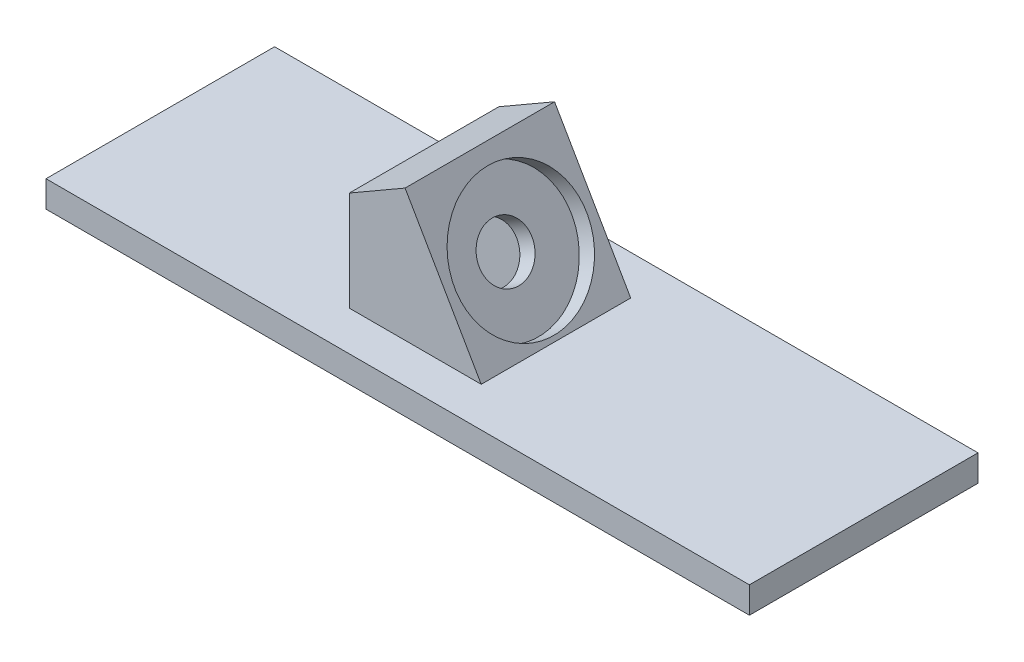
from build123d import *

# Parameters (mm, degrees)
ESBO_O1_R                  = 1.5
RESSALTO_EXTRUS_O1_DEPTH   = 12
RESSALTO_EXTRUS_O1_2_DEPTH = 12
ESBO_O1_R_2                = 1.500000005
RESSALTO_EXTRUS_O1_3_DEPTH = 12
RESSALTO_EXTRUS_O1_4_DEPTH = 12
RESSALTO_EXTRUS_O1_5_DEPTH = 12
RESSALTO_EXTRUS_O1_6_DEPTH = 12
ESBO_O1_R_3                = 1.500000003
RESSALTO_EXTRUS_O1_7_DEPTH = 12
RESSALTO_EXTRUS_O1_8_DEPTH = 12
ESBO_O2_W                  = 79.998506149
ESBO_O2_H                  = 25.999999951
RESSALTO_EXTRUS_O2_DEPTH   = 3
ESBO_O3_W                  = 15
ESBO_O3_H                  = 17
RESSALTO_EXTRUS_O3_DEPTH   = 15
CHANFRO1_START             = 28.832866647
CHANFRO1_OUTLINE_W         = 17.320508076
CHANFRO1_OUTLINE_H         = 17
CHANFRO1_DEPTH             = 8.167133353
ESBO_O4_R                  = 7.5
CORTE_EXTRUS_O3_DEPTH      = 2
ESBO_O5_R                  = 3
CORTE_EXTRUS_O4_DEPTH      = 2
ESBO_O6_W                  = 8.5
ESBO_O6_H                  = 8.5
CORTE_EXTRUS_O5_DEPTH      = 9
ESBO_O7_W                  = 8.495190528
ESBO_O7_H                  = 8.490637191
CORTE_EXTRUS_O6_DEPTH      = 71.124048339
CORTE_EXTRUS_O7_START      = 1
ESBO_O10_W                 = 32.298347435
ESBO_O10_H                 = 12
CORTE_EXTRUS_O7_DEPTH      = 102
CORTE_EXTRUS_O9_REACH      = 63.707
ESBO_O13_W                 = 8.5
ESBO_O13_H                 = 3.123983639
ESBO_O14_W                 = 17
ESBO_O14_H                 = 3.169872981
CORTE_EXTRUS_O10_DEPTH     = 10


with BuildPart() as part:
    # Esboço1 → Ressalto-extrusão1 (new body)
    with BuildSketch(Plane(origin=(0, 0, 0), x_dir=(1, 0, 0), z_dir=(0, 1, 0))):
        with Locations(Location((-18.866927397, -4.302093178, 0), (0, 0, 270))):
            Circle(ESBO_O1_R)
    extrude(amount=RESSALTO_EXTRUS_O1_DEPTH)



with BuildPart() as body_2:
    # Esboço1 → Ressalto-extrus_o1 2 (new body)
    with BuildSketch(Plane(origin=(0, 0, 0), x_dir=(1, 0, 0), z_dir=(0, 1, 0))):
        with Locations(Location((-18.868421246, 18.697906773, 0), (0, 0, 270))):
            Circle(ESBO_O1_R)
    extrude(amount=RESSALTO_EXTRUS_O1_2_DEPTH)


with BuildPart() as body_3:
    # Esboço1 → Ressalto-extrus_o1 3 (new body)
    with BuildSketch(Plane(origin=(0, 0, 0), x_dir=(1, 0, 0), z_dir=(0, 1, 0))):
        with Locations(Location((3.131578748, 18.697379942, 0), (0, 0, 270))):
            Circle(ESBO_O1_R_2)
    extrude(amount=RESSALTO_EXTRUS_O1_3_DEPTH)


with BuildPart() as body_4:
    # Esboço1 → Ressalto-extrus_o1 4 (new body)
    with BuildSketch(Plane(origin=(0, 0, 0), x_dir=(1, 0, 0), z_dir=(0, 1, 0))):
        with Locations(Location((3.133072603, -4.302620009, 0), (0, 0, 270))):
            Circle(ESBO_O1_R)
    extrude(amount=RESSALTO_EXTRUS_O1_4_DEPTH)


with BuildPart() as body_5:
    # Esboço1 → Ressalto-extrus_o1 5 (new body)
    with BuildSketch(Plane(origin=(0, 0, 0), x_dir=(1, 0, 0), z_dir=(0, 1, 0))):
        with Locations(Location((58.131578752, 18.697406939, 0), (0, 0, 270))):
            Circle(ESBO_O1_R)
    extrude(amount=RESSALTO_EXTRUS_O1_5_DEPTH)


with BuildPart() as body_6:
    # Esboço1 → Ressalto-extrus_o1 6 (new body)
    with BuildSketch(Plane(origin=(0, 0, 0), x_dir=(1, 0, 0), z_dir=(0, 1, 0))):
        with Locations(Location((58.131578752, -4.302593061, 0), (0, 0, 270))):
            Circle(ESBO_O1_R)
    extrude(amount=RESSALTO_EXTRUS_O1_6_DEPTH)


with BuildPart() as body_7:
    # Esboço1 → Ressalto-extrus_o1 7 (new body)
    with BuildSketch(Plane(origin=(0, 0, 0), x_dir=(1, 0, 0), z_dir=(0, 1, 0))):
        with Locations(Location((26.131578746, 18.696829164, 0), (0, 0, 270))):
            Circle(ESBO_O1_R_3)
    extrude(amount=RESSALTO_EXTRUS_O1_7_DEPTH)


with BuildPart() as body_8:
    # Esboço1 → Ressalto-extrus_o1 8 (new body)
    with BuildSketch(Plane(origin=(0, 0, 0), x_dir=(1, 0, 0), z_dir=(0, 1, 0))):
        with Locations(Location((26.133072603, -4.303170787, 0), (0, 0, 270))):
            Circle(ESBO_O1_R)
    extrude(amount=RESSALTO_EXTRUS_O1_8_DEPTH)


with BuildPart() as part_1:
    add(part.part)

    add(body_2.part)  # Ressalto-extrusão2 merges body 2

    add(body_3.part)  # Ressalto-extrusão2 merges body 3

    add(body_4.part)  # Ressalto-extrusão2 merges body 4

    add(body_5.part)  # Ressalto-extrusão2 merges body 5

    add(body_6.part)  # Ressalto-extrusão2 merges body 6

    add(body_7.part)  # Ressalto-extrusão2 merges body 7

    add(body_8.part)  # Ressalto-extrusão2 merges body 8
    # Esboço2 → Ressalto-extrusão2 (add)
    with BuildSketch(Plane(origin=(0, 12, 0), x_dir=(1, 0, 0), z_dir=(0, 1, 0))):
        with Locations((19.632325677, 7.197906797)):
            Rectangle(ESBO_O2_W, ESBO_O2_H)
    extrude(amount=RESSALTO_EXTRUS_O2_DEPTH)

    # Esboço3 → Ressalto-extrusão3 (add)
    with BuildSketch(Plane(origin=(0, 15, 0), x_dir=(1, 0, 0), z_dir=(0, 1, 0))):
        with Locations((17.133072603, 7.197906773)):
            Rectangle(ESBO_O3_W, ESBO_O3_H)
    extrude(amount=RESSALTO_EXTRUS_O3_DEPTH)

    # Chanfro1: read off the stored shape, not the designer's step
    # Chanfro1 outline → Chanfro1 (cut)
    with BuildSketch(Plane(origin=(0, 0, 0), x_dir=(0.49999999999999767, -0.86602540378444, 0), z_dir=(0.8660254037844399, 0.49999999999999795, 0)).offset(CHANFRO1_START)):
        with Locations((-9.334098793, 7.197906773)):
            Rectangle(CHANFRO1_OUTLINE_W, CHANFRO1_OUTLINE_H)
    extrude(amount=CHANFRO1_DEPTH, mode=Mode.SUBTRACT)

    # Esboço4 → Corte-extrusão3 (cut)
    with BuildSketch(Plane(origin=(24.96999498, 14.416433324, 0), x_dir=(0, 0, -1), z_dir=(0.8660254037844396, 0.4999999999999982, 0))):
        with Locations(Location((7.197906773, 8.673844755, 0), (0, 0, 90))):
            Circle(ESBO_O4_R)
    extrude(amount=-CORTE_EXTRUS_O3_DEPTH, mode=Mode.SUBTRACT)

    # Esboço5 → Corte-extrusão4 (cut)
    with BuildSketch(Plane(origin=(23.237944173, 13.416433324, 0), x_dir=(0, 0, -1), z_dir=(0.8660254037844398, 0.4999999999999983, 0))):
        with Locations(Location((7.197906773, 8.673844755, 0), (0, 0, 90))):
            Circle(ESBO_O5_R)
    extrude(amount=-CORTE_EXTRUS_O4_DEPTH, mode=Mode.SUBTRACT)

    # Esboço6 → Corte-extrusão5 (cut)
    with BuildSketch(Plane(origin=(21.505893365, 12.416433324, 0), x_dir=(0, 0, -1), z_dir=(0.8660254037844396, 0.49999999999999833, 0))):
        with Locations((7.197906773, 8.673844755)):
            Rectangle(ESBO_O6_W, ESBO_O6_H)
    extrude(amount=-CORTE_EXTRUS_O5_DEPTH, mode=Mode.SUBTRACT)

    # Esboço7 → Corte-extrusão6 (cut, through all)
    with BuildSketch(Plane(origin=(-2.211922378, 3.831161941, 0), x_dir=(0.8660254037844396, 0.49999999999999845, 0), z_dir=(-0.49999999999999845, 0.8660254037844396, 0))):
        with Locations((20.585271383, 7.202588178)):
            Rectangle(ESBO_O7_W, ESBO_O7_H)
    extrude(amount=-CORTE_EXTRUS_O6_DEPTH, mode=Mode.SUBTRACT)

    # Esboço10 → Corte-extrusão7 (cut)
    with BuildSketch(Plane.ZY.offset(20.366927397).offset(CORTE_EXTRUS_O7_START)):
        with Locations((-7.642594808, 6)):
            Rectangle(ESBO_O10_W, ESBO_O10_H)
    extrude(amount=-CORTE_EXTRUS_O7_DEPTH, mode=Mode.SUBTRACT)

    # Corte-extrusão9: up to this plane
    corte_extrus_o9_end = Plane(origin=(21.505893365, 12.416433324, 0), z_dir=(0.8660254037844397, 0.49999999999999806, 0))
    # Esboço13 → Corte-extrusão9 (cut, up to the surface)
    with BuildSketch(Plane.ZY.offset(-9.633072603), mode=Mode.PRIVATE) as corte_extrus_o9_sk1:
        with Locations((-7.197906773, 22.046819377)):
            Rectangle(ESBO_O13_W, ESBO_O13_H)
    corte_extrus_o9_tool1 = split(extrude(corte_extrus_o9_sk1.sketch, amount=-CORTE_EXTRUS_O9_REACH, mode=Mode.PRIVATE), bisect_by=corte_extrus_o9_end, keep=Keep.BOTH, mode=Mode.PRIVATE)
    add(corte_extrus_o9_tool1.solids().sort_by_distance((9.633073, 22.046819, -7.197907))[0], mode=Mode.SUBTRACT)

    # Esboço14 → Corte-extrusão10 (cut)
    with BuildSketch(Plane(origin=(24.96999498, 14.416433324, 0), x_dir=(0, 0, -1), z_dir=(0.8660254037844396, 0.4999999999999985, 0))):
        with Locations((7.197906773, 19.579289321)):
            Rectangle(ESBO_O14_W, ESBO_O14_H)
    extrude(amount=-CORTE_EXTRUS_O10_DEPTH, mode=Mode.SUBTRACT)


solid = part_1.part
